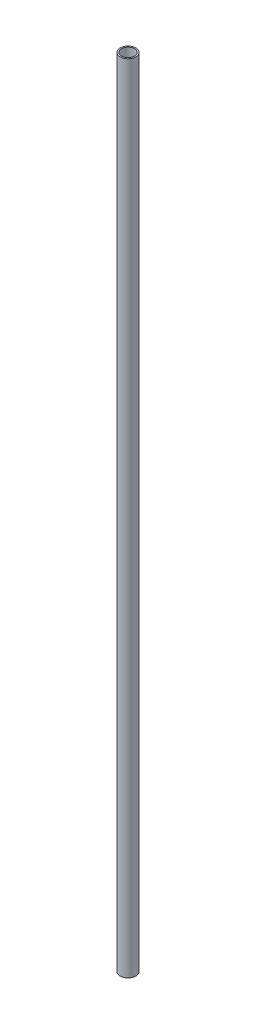
from build123d import *

# Parameters (mm, degrees)
SKETCH1_R           = 5.9944
SKETCH1_R_2         = 4.953
BOSS_EXTRUDE1_DEPTH = 609.6


with BuildPart() as part:
    # Sketch1 → Boss-Extrude1 (new body)
    with BuildSketch(Plane(origin=(0, 0, 0), x_dir=(1, 0, 0), z_dir=(0, 1, 0))):
        Circle(SKETCH1_R)
        Circle(SKETCH1_R_2, mode=Mode.SUBTRACT)
    extrude(amount=BOSS_EXTRUDE1_DEPTH)


solid = part.part
